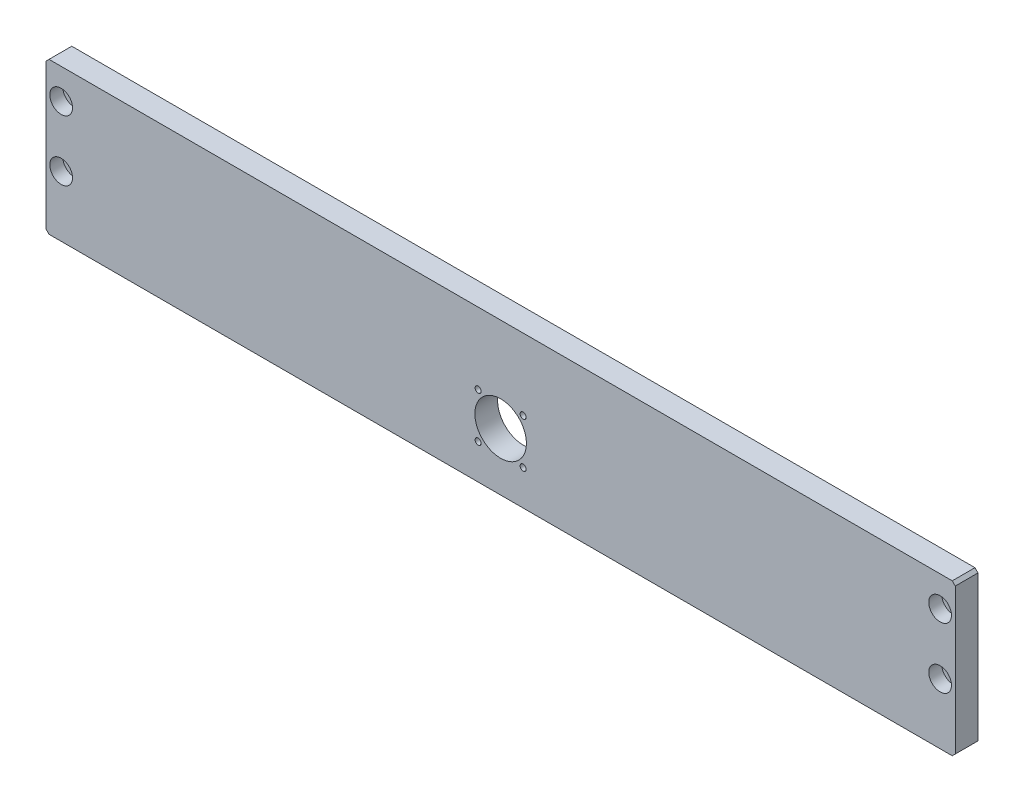
from build123d import *

# Parameters (mm, degrees)
SCHIZZO1_R                                          = 17
SCHIZZO1_R_2                                        = 2
ESTRUSIONE_ESTRUSIONE1_DEPTH                        = 15
M8_TAPPED_HOLE1_D                                   = 6.8
M8_TAPPED_HOLE1_DEPTH                               = 23.75
M8_TAPPED_HOLE1_TIP                                 = 2.042926105
CBORE_FOR_M8_HEX_SOCKET_HEAD_CAP_SCREW1_D           = 9
CBORE_FOR_M8_HEX_SOCKET_HEAD_CAP_SCREW1_DEPTH       = 23.75
CBORE_FOR_M8_HEX_SOCKET_HEAD_CAP_SCREW1_CBORE_D     = 15
CBORE_FOR_M8_HEX_SOCKET_HEAD_CAP_SCREW1_CBORE_DEPTH = 8.6


with BuildPart() as part:
    # Schizzo1 → Estrusione-Estrusione1 (new body)
    with BuildSketch(Plane.XY):
        Polygon((2, 0), (598, 0), (600, 2), (600, 98), (598, 100), (2, 100), (0, 98), (0, 2), align=None)
        with Locations((300, 38)):
            Circle(SCHIZZO1_R, mode=Mode.SUBTRACT)
        with Locations((314.849242405, 52.849242405)):
            Circle(SCHIZZO1_R_2, mode=Mode.SUBTRACT)
        with Locations((314.849242405, 23.150757595)):
            Circle(SCHIZZO1_R_2, mode=Mode.SUBTRACT)
        with Locations((285.150757595, 23.150757595)):
            Circle(SCHIZZO1_R_2, mode=Mode.SUBTRACT)
        with Locations((285.150757595, 52.849242405)):
            Circle(SCHIZZO1_R_2, mode=Mode.SUBTRACT)
    extrude(amount=-ESTRUSIONE_ESTRUSIONE1_DEPTH)

    # M8 Tapped Hole1
    with Locations(Plane(origin=(30, 0, -7.5), x_dir=(0, 0, -1), z_dir=(0, -1, 0))):
        with Locations((0, 0), (0, 540)):
            Hole(M8_TAPPED_HOLE1_D / 2, depth=M8_TAPPED_HOLE1_DEPTH)
            with Locations((0, 0, -(M8_TAPPED_HOLE1_DEPTH + M8_TAPPED_HOLE1_TIP / 2))):  # 118° drill point
                Cone(0, M8_TAPPED_HOLE1_D / 2, M8_TAPPED_HOLE1_TIP, mode=Mode.SUBTRACT)

    # CBORE for M8 Hex Socket Head Cap Screw1
    with Locations(Plane(origin=(10, 80, 0), x_dir=(1, 0, 0), z_dir=(0, 0, 1))):
        with Locations((0, 0), (0, -40), (580, 0), (580, -40)):
            CounterBoreHole(CBORE_FOR_M8_HEX_SOCKET_HEAD_CAP_SCREW1_D / 2, CBORE_FOR_M8_HEX_SOCKET_HEAD_CAP_SCREW1_CBORE_D / 2, CBORE_FOR_M8_HEX_SOCKET_HEAD_CAP_SCREW1_CBORE_DEPTH, depth=CBORE_FOR_M8_HEX_SOCKET_HEAD_CAP_SCREW1_DEPTH)


solid = part.part
